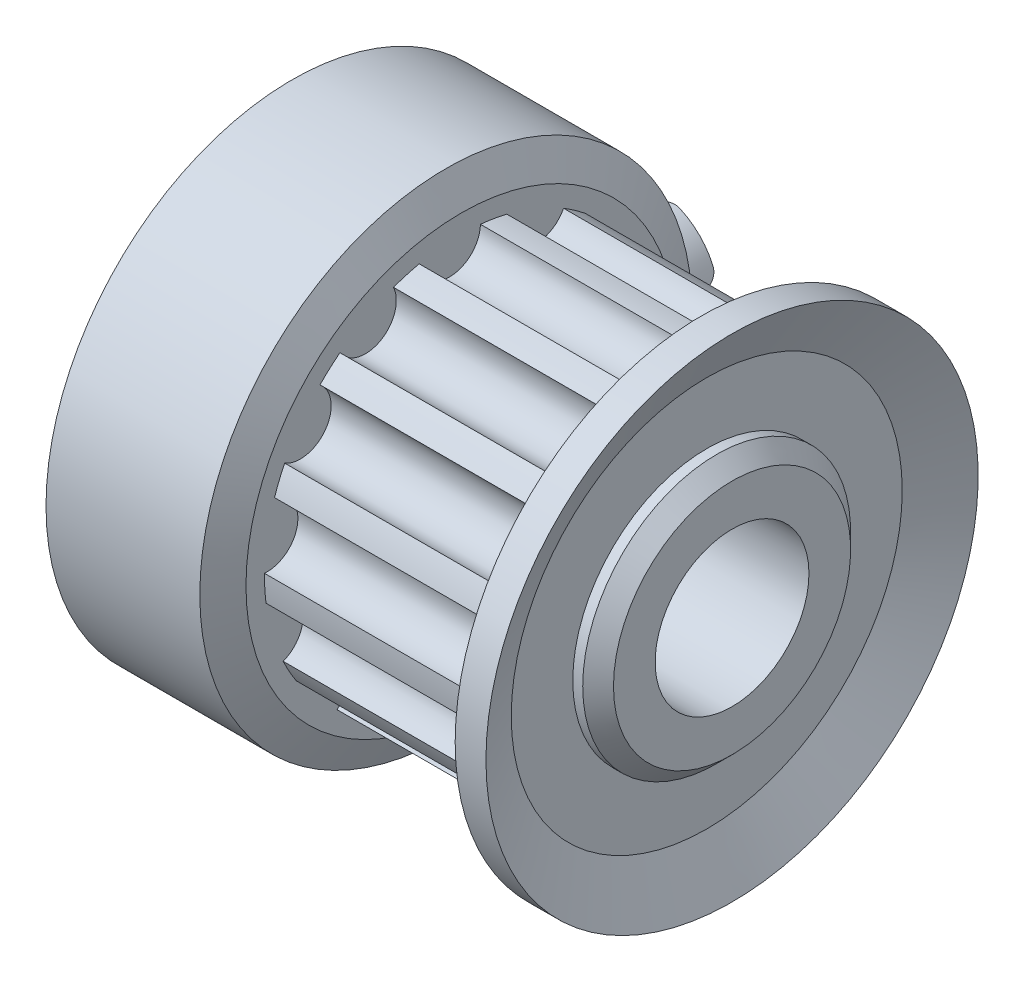
from build123d import *

# Parameters (mm, degrees)
SKETCH3_R           = 2.5
CUT_EXTRUDE1_DEPTH  = 20.243613534
CUT_EXTRUDE2_DEPTH  = 7.0000001
SKETCH5_R           = 1.5
CUT_EXTRUDE3_DEPTH  = 20.243613534
FILLET1_R           = 0.2
SCALE1_SCALE        = 2.4
SKETCH6_R           = 3.6
BOSS_EXTRUDE1_DEPTH = 11
SKETCH7_R           = 5
BOSS_EXTRUDE2_DEPTH = 2
SKETCH10_R          = 5
BOSS_EXTRUDE5_DEPTH = 2
CUT_EXTRUDE4_DEPTH  = 1
FILLET2_R           = 1
FILLET3_START       = -5
FILLET3_DEPTH       = 5.342200255
FILLET3_START_2     = -6
FILLET3_2_DEPTH     = 11
FILLET4_R           = 0.1


with BuildPart() as part:
    # Sketch2 → Revolve1 (revolve)
    with BuildSketch(Plane.XY, mode=Mode.PRIVATE) as revolve1_sk:
        with BuildLine():
            Line((0, 8.342197912), (0, 5.242197912))
            ThreePointArc((0, 5.242197912), (0.029289322, 5.171487234), (0.1, 5.142197912))
            Line((0.1, 5.142197912), (0.3, 5.142197912))
            Line((0.3, 5.142197912), (0, 4.842197912))
            Line((0, 4.842197912), (0, 1.342197912))
            Line((0, 1.342197912), (14.8, 1.342197912))
            Line((14.8, 1.342197912), (14.8, 5.196451881))
            Line((14.8, 5.196451881), (14.3, 5.696451881))
            Line((14.3, 5.696451881), (13.977126984, 5.696451881))
            Line((13.977126984, 5.696451881), (13.977126984, 7.696451881))
            Line((13.977126984, 7.696451881), (14.8, 9.342197912))
            Line((14.8, 9.342197912), (13.8, 9.342197912))
            Line((13.8, 9.342197912), (13, 7.742197912))
            Line((13, 7.742197912), (6, 7.742197912))
            Line((6, 7.742197912), (6, 8.342197912))
            Line((6, 8.342197912), (5.5, 9.342197912))
            Line((5.5, 9.342197912), (0.5, 9.342197912))
            Line((0.5, 9.342197912), (0, 8.342197912))
        make_face()
    revolve(revolve1_sk.sketch.rotate(Axis((0, 1.342197912, 0), (1, 0, 0)), 90), axis=Axis((0, 1.342197912, 0), (1, 0, 0)))

    # Sketch3 → Cut-Extrude1 (cut, through all)
    with BuildSketch(Plane(origin=(14.8, 0, 0), x_dir=(0, 0, -1), z_dir=(1, 0, 0))):
        with Locations((0, 1.342197912)):
            Circle(SKETCH3_R)
    extrude(amount=-CUT_EXTRUDE1_DEPTH, mode=Mode.SUBTRACT)

    # Cut-Extrude2: read off the stored shape, not the designer's step
    # Cut-Extrude2 outline → Cut-Extrude2 (cut)
    with BuildSketch(Plane(origin=(6, 0, 0), x_dir=(0, 0, -1), z_dir=(1, 0, 0))):
        with BuildLine():
            ThreePointArc((4.033777977, 6.310964236), (4.015013096, 4.953246214), (5.367115365, 4.828467202))
            ThreePointArc((5.367115365, 4.828467202), (4.758534127, 5.621958765), (4.033777977, 6.310964236))
        make_face()
        with BuildLine():
            ThreePointArc((6.34823934, 2.154513911), (6.144209747, 3.133478623), (5.790175036, 4.068710895))
            ThreePointArc((5.790175036, 4.068710895), (5.18417694, 2.853591128), (6.34823934, 2.154513911))
        make_face()
        with BuildLine():
            ThreePointArc((1.478441439, 7.569092269), (2.050626707, 6.33768889), (3.322968301, 6.811922093))
            ThreePointArc((3.322968301, 6.811922093), (2.430372461, 7.262779784), (1.478441439, 7.569092269))
        make_face()
        with BuildLine():
            ThreePointArc((-1.369718483, 7.593907471), (-0.319911333, 6.732713355), (0.620666612, 7.712031223))
            ThreePointArc((0.620666612, 7.712031223), (-0.379154287, 7.730956949), (-1.369718483, 7.593907471))
        make_face()
        with BuildLine():
            ThreePointArc((6.072016714, -0.680328484), (6.312949273, 0.290213372), (6.399757096, 1.286438443))
            ThreePointArc((6.399757096, 1.286438443), (5.326550959, 0.454586012), (6.072016714, -0.680328484))
        make_face()
        with BuildLine():
            ThreePointArc((-3.946588903, 6.380495128), (-2.627087262, 6.060080119), (-2.204565745, 7.35051645))
            ThreePointArc((-2.204565745, 7.35051645), (-3.113584859, 6.933762034), (-3.946588903, 6.380495128))
        make_face()
        with BuildLine():
            ThreePointArc((4.593156716, -3.114584715), (5.231331775, -2.344693443), (5.741788776, -1.484790177))
            ThreePointArc((5.741788776, -1.484790177), (4.413936209, -1.768616634), (4.593156716, -3.114584715))
        make_face()
        with BuildLine():
            ThreePointArc((-5.741788991, 4.169186113), (-4.413936223, 4.453012439), (-4.593156798, 5.79898062))
            ThreePointArc((-4.593156798, 5.79898062), (-5.231331773, 5.029089269), (-5.741788991, 4.169186113))
        make_face()
        with BuildLine():
            ThreePointArc((2.204565689, -4.666120499), (3.113584859, -4.249366209), (3.946588775, -3.696099125))
            ThreePointArc((3.946588775, -3.696099125), (2.627087261, -3.375684294), (2.204565689, -4.666120499))
        make_face()
        with BuildLine():
            ThreePointArc((-6.399757097, 1.397957373), (-5.326550934, 2.229809963), (-6.072016908, 3.364724357))
            ThreePointArc((-6.072016908, 3.364724357), (-6.312949275, 2.394182441), (-6.399757097, 1.397957373))
        make_face()
        with BuildLine():
            ThreePointArc((-0.620666603, -5.027635129), (0.379154272, -5.046561125), (1.369718451, -4.909511563))
            ThreePointArc((1.369718451, -4.909511563), (0.31991153, -4.048317519), (-0.620666603, -5.027635129))
        make_face()
        with BuildLine():
            ThreePointArc((-5.790175088, -1.38431511), (-5.184176993, -0.169195123), (-6.348239547, 0.529881871))
            ThreePointArc((-6.348239547, 0.529881871), (-6.144209743, -0.449082812), (-5.790175088, -1.38431511))
        make_face()
        with BuildLine():
            ThreePointArc((-3.322968254, -4.127526211), (-2.430372449, -4.578383965), (-1.478441381, -4.884696264))
            ThreePointArc((-1.478441381, -4.884696264), (-2.050626855, -3.653293004), (-3.322968254, -4.127526211))
        make_face()
        with BuildLine():
            ThreePointArc((-4.033777982, -3.626568417), (-4.015013089, -2.268850397), (-5.367115355, -2.144071369))
            ThreePointArc((-5.367115355, -2.144071369), (-4.758534128, -2.93756294), (-4.033777982, -3.626568417))
        make_face()
    extrude(amount=CUT_EXTRUDE2_DEPTH, mode=Mode.SUBTRACT)

    # Cut-Extrude2 2 outline → Cut-Extrude2 2 (revolve)
    with BuildSketch(Plane(origin=(0, 1.342197912, 0), x_dir=(0, 1, 0), z_dir=(0, 0, -1))):
        Polygon((5.395849736, 13.8), (5.395849736, 12.497924868), (6.400000178, 13.000000089), (8, 13.8), align=None)
    revolve(axis=Axis((0, 1.342197912, 0), (1, 0, 0)))

    # Sketch5 → Cut-Extrude3 (cut, through all)
    with BuildSketch(Plane.XY):
        with Locations((3.5, 1.342197912)):
            Circle(SKETCH5_R)
    extrude(amount=-CUT_EXTRUDE3_DEPTH, mode=Mode.SUBTRACT)

    # Fillet1
    fillet1_edges = [part.edges().sort_by_distance(p)[0] for p in [
        (2, 1.342197912, -8),
    ]]
    fillet(fillet1_edges, radius=FILLET1_R)


with BuildPart() as part_1:
    # Scale1: scaled about (6.384251674, 1.342197284, 0.110707204)
    add(part.part.scale(SCALE1_SCALE).moved(Location((-8.937952344, -1.879076198, -0.154990086))))


with BuildPart() as body_2:
    # Sketch6 → Boss-Extrude1 (new body)
    with BuildSketch(Plane.XY.offset(-19.2)):
        with Locations((-0.53795216, 1.342200255)):
            Circle(SKETCH6_R)
    extrude(amount=BOSS_EXTRUDE1_DEPTH)

    # Sketch7 → Boss-Extrude2 (add)
    with BuildSketch(Plane.XY.offset(-8.2)):
        with Locations((-0.53795216, 1.342200255)):
            Circle(SKETCH7_R)
    extrude(amount=BOSS_EXTRUDE2_DEPTH)


with BuildPart() as boss_extrude5_tool:
    # Sketch10 → Boss-Extrude5 (new body)
    with BuildSketch(Plane(origin=(0, 0, -19.2), x_dir=(-1, 0, 0), z_dir=(0, 0, -1))):
        with Locations(Location((0.53795216, 1.342200255, 0), (0, 0, 193.625179531))):
            Circle(SKETCH10_R)
    extrude(amount=BOSS_EXTRUDE5_DEPTH)


with BuildPart() as part_2:
    add(part_1.part)


with BuildPart() as part_3:
    # Boss-Extrude5: joined with boss_extrude5_tool
    add(part_2.part.fuse(boss_extrude5_tool.part, body_2.part, tol=0.00001))

    # Sketch11 → Cut-Extrude4 (cut)
    with BuildSketch(Plane(origin=(0, 0, -21.2), x_dir=(-1, 0, 0), z_dir=(0, 0, -1))):
        Polygon((-0.46204784, 2.342200255), (-0.46204784, 7.423865253), (1.53795216, 7.423865253), (1.53795216, 2.342200255), (6.857150432, 2.342200255), (6.857150432, 0.342200255), (1.53795216, 0.342200255), (1.53795216, -4.739464743), (-0.46204784, -4.739464743), (-0.46204784, 0.342200255), (-5.781246112, 0.342200255), (-5.781246112, 2.342200255), align=None)
    extrude(amount=-CUT_EXTRUDE4_DEPTH, mode=Mode.SUBTRACT)

    # Fillet2
    fillet2_edges = [part_3.edges().sort_by_distance(p)[0] for p in [
        (2.411537583, 2.342200255, -21.2),
        (-3.487441903, 2.342200255, -21.2),
        (-1.53795216, 4.291689997, -21.2),
        (0.46204784, 4.291689997, -21.2),
    ]]
    fillet(fillet2_edges, radius=FILLET2_R - 0.0001)  # a hair under: the kernel refuses the full size

    # Fillet3: read off the stored shape, not the designer's step
    # Fillet3 outline → Fillet3 (cut)
    with BuildSketch(Plane(origin=(0, 0, 0), x_dir=(1, 0, 0), z_dir=(0, 1, 0)).offset(FILLET3_START)):
        with BuildLine():
            ThreePointArc((0.46204784, 20.2), (0.754941059, 20.907106781), (1.46204784, 21.2))
            Line((1.46204784, 21.2), (0.46204784, 21.2))
            Line((0.46204784, 21.2), (0.46204784, 20.2))
        make_face()
        with BuildLine():
            Line((-1.53795216, 21.2), (-2.53795216, 21.2))
            ThreePointArc((-2.53795216, 21.2), (-1.830845379, 20.907106781), (-1.53795216, 20.2))
            Line((-1.53795216, 20.2), (-1.53795216, 21.2))
        make_face()
    extrude(amount=FILLET3_DEPTH, mode=Mode.SUBTRACT)

    # Fillet3 2 outline → Fillet3 2 (cut)
    with BuildSketch(Plane.YZ.offset(FILLET3_START_2)):
        with BuildLine():
            ThreePointArc((0.342200255, -20.2), (0.049307036, -20.907106781), (-0.657799745, -21.2))
            Line((-0.657799745, -21.2), (0.342200255, -21.2))
            Line((0.342200255, -21.2), (0.342200255, -20.2))
        make_face()
    extrude(amount=FILLET3_2_DEPTH, mode=Mode.SUBTRACT)

    # Fillet4
    fillet4_edges = [part_3.edges().sort_by_distance(p)[0] for p in [
        (-0.53795216, -3.657799745, -19.2),
        (-0.53795216, 6.342200255, -19.2),
    ]]
    fillet(fillet4_edges, radius=FILLET4_R)


solid = part_3.part
